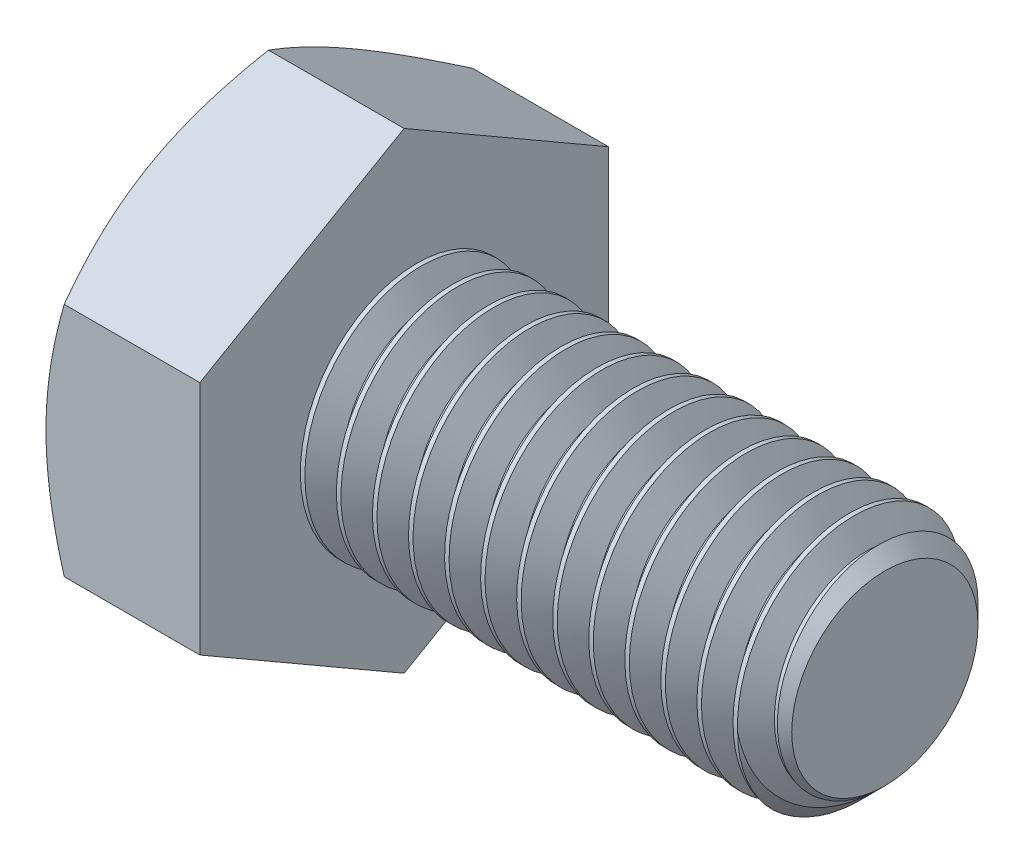
from build123d import *

# Parameters (mm, degrees)
SKETCH2_R           = 5
BOSS_EXTRUDE1_DEPTH = 20
CHAMFER1_SIZE       = 1.125
CUT_SWEEP1_PITCH    = 1.5
BOSS_EXTRUDE2_DEPTH = 6.4
SKETCH6_OUTSIDE_W   = 131.784
SKETCH6_OUTSIDE_H   = 134.414
SKETCH6_OUTSIDE_R   = 8.5
CUT_EXTRUDE1_DEPTH  = 30.420117985
CUT_EXTRUDE1_DRAFT  = -60


with BuildPart() as part:
    # Sketch2 → Boss-Extrude1 (new body)
    with BuildSketch(Plane(origin=(13.2, 0, 0), x_dir=(0, 0, -1), z_dir=(1, 0, 0))):
        Circle(SKETCH2_R)
    extrude(amount=-BOSS_EXTRUDE1_DEPTH)

    # Chamfer1
    chamfer1_edges = [part.edges().sort_by_distance(p)[0] for p in [
        (13.2, 0, 5),
    ]]
    chamfer(chamfer1_edges, length=CHAMFER1_SIZE)

    # Cut-Sweep1: the profile of Sketch5 profile screwed along a right-hand helix of 14.333333 turns, 8 arcs to a turn; built about Z, then put on its axis
    cut_sweep1_z = Axis((0, 0, 0), (0, 0, 1))
    cut_sweep1_corners = [(5.0003, 0, 0.000173205), (4.025721421, 0, -0.5625), (4.025721421, 0, -0.75), (5.0003, 0, -1.312673205)]
    with BuildLine(mode=Mode.PRIVATE) as cut_sweep1_profile:
        Line(cut_sweep1_corners[0], cut_sweep1_corners[1])
        Line(cut_sweep1_corners[1], cut_sweep1_corners[2])
        Line(cut_sweep1_corners[2], cut_sweep1_corners[3])
        Line(cut_sweep1_corners[3], cut_sweep1_corners[0])
    cut_sweep1_cap = Face(cut_sweep1_profile.wire())
    cut_sweep1_turn_angles = [0, 22.5, 45, 67.5, 90, 112.5, 135, 157.5, 180, 202.5, 225, 247.5, 270, 292.5, 315, 337.5, 360]
    cut_sweep1_turn_weights = [1, 0.9238795325112867, 1, 0.9238795325112867, 1, 0.9238795325112867, 1, 0.9238795325112867, 1, 0.9238795325112867, 1, 0.9238795325112867, 1, 0.9238795325112867, 1, 0.9238795325112867, 1]
    cut_sweep1_turn_rails = [Edge.make_bspline([Vector(p[0], p[1], 0).rotate(cut_sweep1_z, cut_sweep1_turn_angles[k]) / cut_sweep1_turn_weights[k] + Vector(0, 0, p[2] + CUT_SWEEP1_PITCH * cut_sweep1_turn_angles[k] / 360) for k in range(17)], [0, 0, 0, 1, 1, 2, 2, 3, 3, 4, 4, 5, 5, 6, 6, 7, 7, 8, 8, 8], 2, cut_sweep1_turn_weights) for p in cut_sweep1_corners]
    cut_sweep1_turn_sides = [Face.make_surface_from_curves(cut_sweep1_turn_rails[p[0]], cut_sweep1_turn_rails[p[1]]) for p in [(0, 1), (1, 2), (2, 3), (3, 0)]]
    cut_sweep1_last_angles = [5040, 5062.5, 5085, 5107.5, 5130, 5145, 5160]
    cut_sweep1_last_weights = [1, 0.9238795325112867, 1, 0.9238795325112867, 1, 0.9659258262890642, 1]
    cut_sweep1_last_rails = [Edge.make_bspline([Vector(p[0], p[1], 0).rotate(cut_sweep1_z, cut_sweep1_last_angles[k]) / cut_sweep1_last_weights[k] + Vector(0, 0, p[2] + CUT_SWEEP1_PITCH * cut_sweep1_last_angles[k] / 360) for k in range(7)], [0, 0, 0, 1, 1, 2, 2, 3, 3, 3], 2, cut_sweep1_last_weights) for p in cut_sweep1_corners]
    cut_sweep1_last_sides = [Face.make_surface_from_curves(cut_sweep1_last_rails[p[0]], cut_sweep1_last_rails[p[1]]) for p in [(0, 1), (1, 2), (2, 3), (3, 0)]]
    cut_sweep1 = Plane(origin=(13.2, 0, 0), x_dir=(0, 1, 0), z_dir=(-1, 0, 0)) * Solid(Shell([*[p.moved(Location((0, 0, CUT_SWEEP1_PITCH * i))) for i in range(14) for p in cut_sweep1_turn_sides], *cut_sweep1_last_sides, cut_sweep1_cap, cut_sweep1_cap.rotate(cut_sweep1_z, 5160).moved(Location((0, 0, CUT_SWEEP1_PITCH * 5160 / 360)))]))
    add(cut_sweep1, mode=Mode.SUBTRACT)

    # Sketch3 → Boss-Extrude2 (add)
    with BuildSketch(Plane.ZY.offset(6.8)):
        Polygon((-8.5, -4.907477288), (0, -9.814954576), (8.5, -4.907477288), (8.5, 4.907477288), (0, 9.814954576), (-8.5, 4.907477288), align=None)
    extrude(amount=BOSS_EXTRUDE2_DEPTH)


with BuildPart() as cut_extrude1_tool:
    # Sketch6 outside → Cut-Extrude1 (with draft: the straight prism first)
    with BuildSketch(Plane.ZY.offset(13.2)):
        Rectangle(SKETCH6_OUTSIDE_W, SKETCH6_OUTSIDE_H)
        Circle(SKETCH6_OUTSIDE_R, mode=Mode.SUBTRACT)
    extrude(amount=-CUT_EXTRUDE1_DEPTH)
    # Cut-Extrude1: the draft: its side faces are tilted about the plane it starts from
    cut_extrude1_sides = [cut_extrude1_tool.faces().sort_by_distance(p)[0] for p in [
        (2.010058993, -67.207, 0),
        (2.010058993, 0, 65.892),
        (2.010058993, 67.207, 0),
        (2.010058993, 0, -65.892),
        (2.010058993, 0, -8.5),
    ]]
    draft(cut_extrude1_sides, Plane.ZY.offset(13.2), CUT_EXTRUDE1_DRAFT)


with BuildPart() as part_1:
    add(part.part)

    # Cut-Extrude1: cut by cut_extrude1_tool
    add(cut_extrude1_tool.part, mode=Mode.SUBTRACT)


solid = part_1.part
